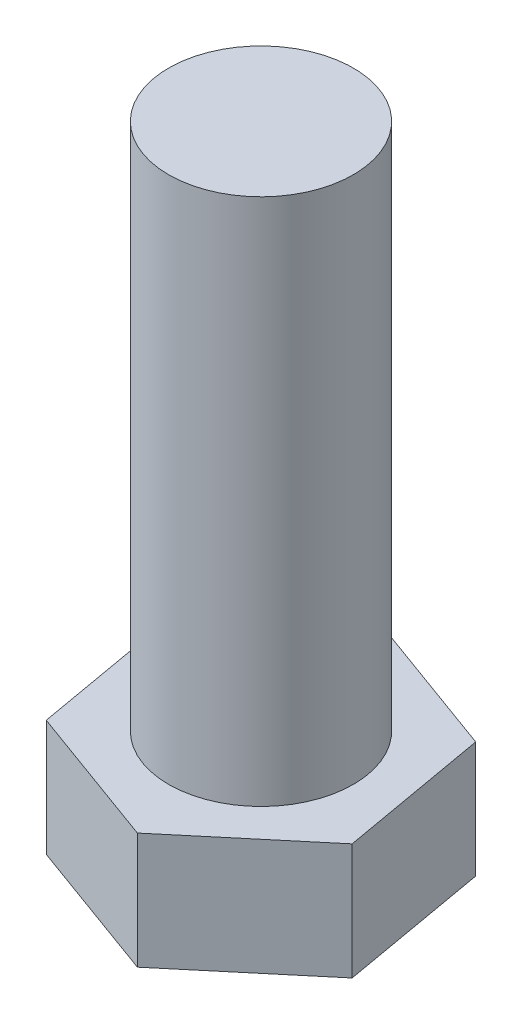
from build123d import *

# Parameters (mm, degrees)
EXTRUDE_1_DEPTH = 8.8
SKETCH_3_R      = 7
EXTRUDE_2_DEPTH = 40


with BuildPart() as part:
    # Эскиз1 → Вытянуть1 (new body)
    with BuildSketch(Plane(origin=(0, 0, 0), x_dir=(1, 0, 0), z_dir=(0, 1, 0))):
        Polygon((2.006700186, -11.371301056), (10.851185681, -3.947797189), (8.844485495, 7.423503867), (-2.006700186, 11.371301056), (-10.851185681, 3.947797189), (-8.844485495, -7.423503867), align=None)
    extrude(amount=EXTRUDE_1_DEPTH)

    # Эскиз3 → Вытянуть2 (add)
    with BuildSketch(Plane(origin=(0, 8.8, 0), x_dir=(1, 0, 0), z_dir=(0, 1, 0))):
        Circle(SKETCH_3_R)
    extrude(amount=EXTRUDE_2_DEPTH)


solid = part.part
